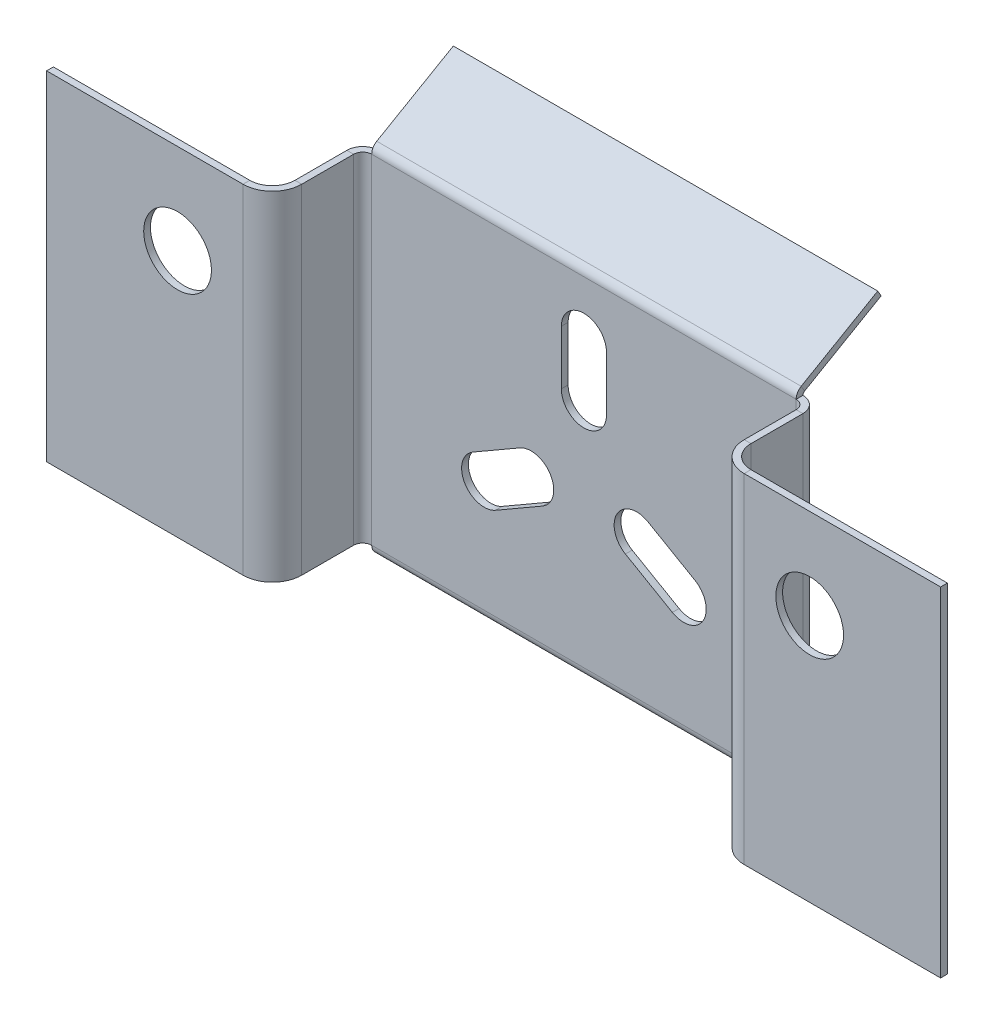
from build123d import *

# Parameters (mm, degrees)
SKETCH1_W                    = 94
SKETCH1_H                    = 75
BASE_FLANGE1_DEPTH           = 1.5
EDGE_FLANGE1_DEPTH           = 75
EDGE_FLANGE2_STRIP_W         = 16
EDGE_FLANGE2_STRIP_H         = 1.5
EDGE_FLANGE2_STRIP_CUT_DEPTH = 75
EDGE_FLANGE2_DEPTH           = 75
EDGE_FLANGE3_DEPTH           = 75
EDGE_FLANGE4_STRIP_W         = 16
EDGE_FLANGE4_STRIP_H         = 1.5
EDGE_FLANGE4_STRIP_CUT_DEPTH = 75
EDGE_FLANGE4_DEPTH           = 75
SKETCH18_R                   = 7.5
CUT_EXTRUDE1_DEPTH           = 10
EDGE_FLANGE5_DEPTH           = 94
EDGE_FLANGE6_DEPTH           = 94


# Sheet-metal steps are written as plain solids
with BuildPart() as part:
    # Sketch1 → Base-Flange1 (new body)
    with BuildSketch(Plane.XY):
        Rectangle(SKETCH1_W, SKETCH1_H)
        with BuildLine():
            Line((5, 25.5), (5, 13.5))
            ThreePointArc((5, 13.5), (0, 8.5), (-5, 13.5))
            Line((-5, 13.5), (-5, 25.5))
            ThreePointArc((-5, 25.5), (0, 30.5), (5, 25.5))
        make_face(mode=Mode.SUBTRACT)
        with BuildLine():
            Line((19.583647797, -17.080127019), (9.191342951, -11.080127019))
            ThreePointArc((9.191342951, -11.080127019), (7.361215932, -4.25), (14.191342951, -2.419872981))
            Line((14.191342951, -2.419872981), (24.583647797, -8.419872981))
            ThreePointArc((24.583647797, -8.419872981), (26.413774815, -15.25), (19.583647797, -17.080127019))
        make_face(mode=Mode.SUBTRACT)
        with BuildLine():
            Line((-24.583647797, -8.419872981), (-14.191342951, -2.419872981))
            ThreePointArc((-14.191342951, -2.419872981), (-7.361215932, -4.25), (-9.191342951, -11.080127019))
            Line((-9.191342951, -11.080127019), (-19.583647797, -17.080127019))
            ThreePointArc((-19.583647797, -17.080127019), (-26.413774815, -15.25), (-24.583647797, -8.419872981))
        make_face(mode=Mode.SUBTRACT)
    extrude(amount=-BASE_FLANGE1_DEPTH)

    # Edge-Flange1 section (across the edge) → Edge-Flange1 (add)
    with BuildSketch(Plane(origin=(49, -37.5, 0), x_dir=(-1, 0, 0), z_dir=(0, 1, 0))):
        with BuildLine():
            Line((-1.5, 2), (-1.5, 18.5))
            Line((-1.5, 18.5), (0, 18.5))
            Line((0, 18.5), (0, 2))
            ThreePointArc((0, 2), (0.585786438, 0.585786438), (2, 0))
            Line((2, 0), (2, -1.5))
            ThreePointArc((2, -1.5), (-0.474873734, -0.474873734), (-1.5, 2))
        make_face()
    extrude(amount=EDGE_FLANGE1_DEPTH)

    # Edge-Flange2 strip (across the edge) → Edge-Flange2 strip cut (cut)
    with BuildSketch(Plane(origin=(50.5, 37.5, 18.5), x_dir=(0, 0, -1), z_dir=(0, -1, 0))):
        with Locations((-3, -0.75)):
            Rectangle(EDGE_FLANGE2_STRIP_W, EDGE_FLANGE2_STRIP_H)
    extrude(amount=EDGE_FLANGE2_STRIP_CUT_DEPTH, mode=Mode.SUBTRACT)

    # Edge-Flange2 section (across the edge) → Edge-Flange2 (add)
    with BuildSketch(Plane(origin=(50.5, 37.5, 18.5), x_dir=(0, 0, -1), z_dir=(0, -1, 0))):
        with BuildLine():
            Line((-1.5, 5), (-1.5, 48.5))
            Line((-1.5, 48.5), (0, 48.5))
            Line((0, 48.5), (0, 5))
            ThreePointArc((0, 5), (1.464466094, 1.464466094), (5, 0))
            Line((5, 0), (5, -1.5))
            ThreePointArc((5, -1.5), (0.403805922, 0.403805922), (-1.5, 5))
        make_face()
    extrude(amount=EDGE_FLANGE2_DEPTH)

    # Edge-Flange3 section (across the edge) → Edge-Flange3 (add)
    with BuildSketch(Plane(origin=(-49, 37.5, 0), x_dir=(1, 0, 0), z_dir=(0, -1, 0))):
        with BuildLine():
            Line((-1.5, 2), (-1.5, 18.5))
            Line((-1.5, 18.5), (0, 18.5))
            Line((0, 18.5), (0, 2))
            ThreePointArc((0, 2), (0.585786438, 0.585786438), (2, 0))
            Line((2, 0), (2, -1.5))
            ThreePointArc((2, -1.5), (-0.474873734, -0.474873734), (-1.5, 2))
        make_face()
    extrude(amount=EDGE_FLANGE3_DEPTH)

    # Edge-Flange4 strip (across the edge) → Edge-Flange4 strip cut (cut)
    with BuildSketch(Plane(origin=(-50.5, -37.5, 18.5), x_dir=(0, 0, -1), z_dir=(0, 1, 0))):
        with Locations((-3, -0.75)):
            Rectangle(EDGE_FLANGE4_STRIP_W, EDGE_FLANGE4_STRIP_H)
    extrude(amount=EDGE_FLANGE4_STRIP_CUT_DEPTH, mode=Mode.SUBTRACT)

    # Edge-Flange4 section (across the edge) → Edge-Flange4 (add)
    with BuildSketch(Plane(origin=(-50.5, -37.5, 18.5), x_dir=(0, 0, -1), z_dir=(0, 1, 0))):
        with BuildLine():
            Line((-1.5, 5), (-1.5, 48.5))
            Line((-1.5, 48.5), (0, 48.5))
            Line((0, 48.5), (0, 5))
            ThreePointArc((0, 5), (1.464466094, 1.464466094), (5, 0))
            Line((5, 0), (5, -1.5))
            ThreePointArc((5, -1.5), (0.403805922, 0.403805922), (-1.5, 5))
        make_face()
    extrude(amount=EDGE_FLANGE4_DEPTH)

    # Sketch18 → Cut-Extrude1 (cut)
    with BuildSketch(Plane.XY.offset(20)):
        with Locations((70, 17.5)):
            Circle(SKETCH18_R)
        with Locations(Location((-70, 17.5, 0), (0, 0, 180))):
            Circle(SKETCH18_R)
    extrude(amount=-CUT_EXTRUDE1_DEPTH, mode=Mode.SUBTRACT)

    # Edge-Flange5 section (across the edge) → Edge-Flange5 (add)
    with BuildSketch(Plane(origin=(-47, 37.925276208, -1.5), x_dir=(0, -0.8660254037844364, -0.5000000000000041), z_dir=(1, 0, 0))):
        with BuildLine():
            Line((-1.5, 0.425276208), (-1.5, 20))
            Line((-1.5, 20), (0, 20))
            Line((0, 20), (0, 0.425276208))
            ThreePointArc((0, 0.425276208), (0.098685688, 0.056976208), (0.3683, -0.212638104))
            Line((0.3683, -0.212638104), (-0.3817, -1.51167621))
            ThreePointArc((-0.3817, -1.51167621), (-1.200352418, -0.693023792), (-1.5, 0.425276208))
        make_face()
    extrude(amount=EDGE_FLANGE5_DEPTH)

    # Edge-Flange6 section (across the edge) → Edge-Flange6 (add)
    with BuildSketch(Plane(origin=(47, -37.925276208, -1.5), x_dir=(0, 0.8660254037844364, -0.5000000000000041), z_dir=(-1, 0, 0))):
        with BuildLine():
            Line((-1.5, 0.425276208), (-1.5, 20))
            Line((-1.5, 20), (0, 20))
            Line((0, 20), (0, 0.425276208))
            ThreePointArc((0, 0.425276208), (0.098685688, 0.056976208), (0.3683, -0.212638104))
            Line((0.3683, -0.212638104), (-0.3817, -1.51167621))
            ThreePointArc((-0.3817, -1.51167621), (-1.200352418, -0.693023792), (-1.5, 0.425276208))
        make_face()
    extrude(amount=EDGE_FLANGE6_DEPTH)


solid = part.part
